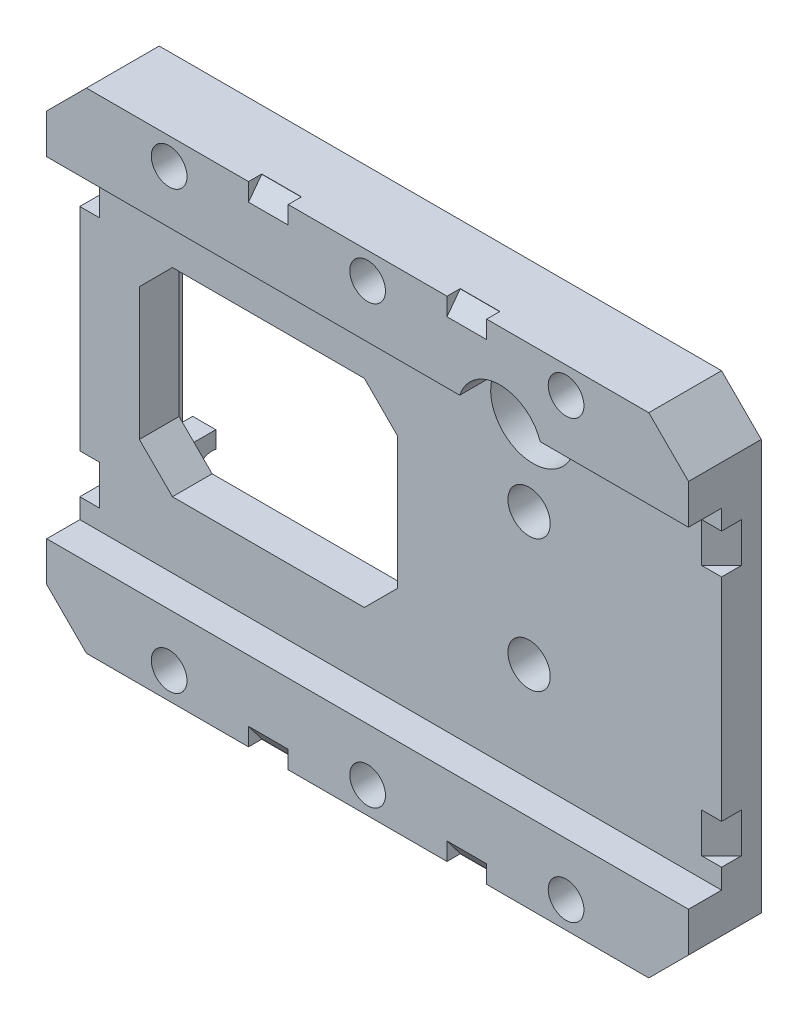
from build123d import *
from OCP.BRepFilletAPI import BRepFilletAPI_MakeChamfer

# Parameters (mm, degrees)
SKETCH_1_W                  = 48.5
SKETCH_1_H                  = 37
EXTRUDE_1_DEPTH             = 7.5
SKETCH_2_W                  = 4.5
SKETCH_2_H                  = 25
CUT_EXTRUDE_1_DEPTH         = 54.398977368
SKETCH_3_W                  = 41
SKETCH_3_H                  = 27.5
EXTRUDE_2_DEPTH             = 3.028
SKETCH_4_W                  = 38.25
SKETCH_4_H                  = 25
CUT_EXTRUDE_2_DEPTH         = 3.028
CUT_EXTRUDE_3_DEPTH         = 49.015109955
CUT_EXTRUDE_4_DEPTH         = 52.139033859
CUT_EXTRUDE_5_DEPTH         = 32.090983966
HOLE_WIZARD_2_5_2_5_1_D     = 2.5
HOLE_WIZARD_2_5_2_5_1_DEPTH = 1.75
HOLE_WIZARD_2_5_2_5_2_D     = 2.5
HOLE_WIZARD_2_5_2_5_2_DEPTH = 6
HOLE_WIZARD_2_5_2_5_3_D     = 2.5
HOLE_WIZARD_2_5_2_5_3_DEPTH = 4.25
HOLE_WIZARD_2_7_2_7_1_D     = 2.7
CHAMFER_1_SIZE              = 3
SKETCH_17_W                 = 3
SKETCH_17_H                 = 4
CUT_EXTRUDE_8_DEPTH         = 3
CHAMFER_2_SIZE              = 3
CHAMFER_2_SIZE_2            = 3.981134465
SKETCH_19_W                 = 2
SKETCH_19_H                 = 3
CUT_EXTRUDE_9_DEPTH         = 1.5
CHAMFER_3_SIZE              = 2
CHAMFER_4_SIZE              = 1
SKETCH_20_R                 = 3.2
CUT_EXTRUDE_10_DEPTH        = 21.5
SKETCH_21_W                 = 19.5
SKETCH_21_H                 = 15
CUT_EXTRUDE_11_DEPTH        = 21.5
CHAMFER_5_SIZE              = 2.5
SKETCH_22_W                 = 9
SKETCH_22_H                 = 15
CUT_EXTRUDE_12_DEPTH        = 51.5
SKETCH_23_W                 = 48.5
SKETCH_23_H                 = 2
CUT_EXTRUDE_13_DEPTH        = 50
SKETCH_24_R                 = 1.6
CUT_EXTRUDE_14_DEPTH        = 10


# Some blends are built 0.0001 mm under size
with BuildPart() as part:
    # 草图1 → 凸台-拉伸1 (new body)
    with BuildSketch(Plane(origin=(0, 0, 5.028), x_dir=(-1, 0, 0), z_dir=(0, 0, -1))):
        Rectangle(SKETCH_1_W, SKETCH_1_H)
    extrude(amount=-EXTRUDE_1_DEPTH)

    # 草图2 → 切除-拉伸1 (cut, through all)
    with BuildSketch(Plane(origin=(24.25, 0, 0), x_dir=(0, 0, -1), z_dir=(1, 0, 0))):
        with Locations((-10.278, 0)):
            Rectangle(SKETCH_2_W, SKETCH_2_H)
    extrude(amount=-CUT_EXTRUDE_1_DEPTH, mode=Mode.SUBTRACT)

    # 草图3 → 凸台-拉伸2 (add)
    with BuildSketch(Plane(origin=(0, 0, 5.028), x_dir=(-1, 0, 0), z_dir=(0, 0, -1))):
        with Locations((1.25, 0)):
            Rectangle(SKETCH_3_W, SKETCH_3_H)
    extrude(amount=EXTRUDE_2_DEPTH)

    # 草图4 → 切除-拉伸2 (cut)
    with BuildSketch(Plane(origin=(0, 0, 2), x_dir=(-1, 0, 0), z_dir=(0, 0, -1))):
        with Locations((0.875, 0)):
            Rectangle(SKETCH_4_W, SKETCH_4_H)
    extrude(amount=-CUT_EXTRUDE_2_DEPTH, mode=Mode.SUBTRACT)

    # 草图5 → 切除-拉伸3 (cut, through all)
    with BuildSketch(Plane.ZY.offset(-18.25)):
        with BuildLine():
            Line((2, 7.034395212), (2, -7.034395212))
            ThreePointArc((2, -7.034395212), (4.278, 0), (2, 7.034395212))
        make_face()
    extrude(amount=-CUT_EXTRUDE_3_DEPTH, mode=Mode.SUBTRACT)

    # 草图6 → 切除-拉伸4 (cut, through all)
    with BuildSketch(Plane.ZY.offset(21.75)):
        with BuildLine():
            Line((2, 7.034395212), (2, -7.034395212))
            ThreePointArc((2, -7.034395212), (4.278, 0), (2, 7.034395212))
        make_face()
    extrude(amount=-CUT_EXTRUDE_4_DEPTH, mode=Mode.SUBTRACT)

    # 草图7 → 切除-拉伸5 (cut, through all)
    with BuildSketch(Plane.XY.offset(8.028)):
        with BuildLine():
            Line((-7.978419869, 7.029222073), (-13.021580131, 7.029222073))
            ThreePointArc((-13.021580131, 7.029222073), (-17.801221513, 4.934335949), (-19.5, 0))
            ThreePointArc((-19.5, 0), (-17.801221513, -4.934335949), (-13.021580131, -7.029222073))
            Line((-13.021580131, -7.029222073), (-7.978419869, -7.029222073))
            ThreePointArc((-7.978419869, -7.029222073), (-3.198778487, -4.934335949), (-1.5, 0))
            ThreePointArc((-1.5, 0), (-3.198778487, 4.934335949), (-7.978419869, 7.029222073))
        make_face()
    extrude(amount=-CUT_EXTRUDE_5_DEPTH, mode=Mode.SUBTRACT)

    # Ø2.5 (2.5) 直径孔1
    with Locations(Plane.ZY.offset(21.75)):
        with Locations((2.278, 10)):
            Hole(HOLE_WIZARD_2_5_2_5_1_D / 2, depth=HOLE_WIZARD_2_5_2_5_1_DEPTH)

    # Ø2.5 (2.5) 直径孔2
    with Locations(Plane.ZY.offset(-18.25)):
        with Locations((2.278, -10), (2.278, 10)):
            Hole(HOLE_WIZARD_2_5_2_5_2_D / 2, depth=HOLE_WIZARD_2_5_2_5_2_DEPTH)

    # Ø2.5 (2.5) 直径孔3
    with Locations(Plane(origin=(-20, 0, 0), x_dir=(0, 0, -1), z_dir=(1, 0, 0))):
        with Locations((-2.278, -10)):
            Hole(HOLE_WIZARD_2_5_2_5_3_D / 2, depth=HOLE_WIZARD_2_5_2_5_3_DEPTH)

    # Ø2.7 (2.7) 直径孔1 (through all)
    with Locations(Plane.XY.offset(12.528)):
        with Locations((0, -16.5), (-15, -16.5), (15, -16.5), (0, 16.5), (-15, 16.5), (15, 16.5)):
            Hole(HOLE_WIZARD_2_7_2_7_1_D / 2)

    # 倒角1
    chamfer_1_edges = [part.edges().sort_by_distance(p)[0] for p in [
        (-24.25, 18.5, 8.778),
        (-24.25, -18.5, 8.778),
        (24.25, -18.5, 8.778),
        (24.25, 18.5, 8.778),
    ]]
    chamfer(chamfer_1_edges, length=CHAMFER_1_SIZE)

    # 草图17 → 切除-拉伸8 (cut)
    with BuildSketch(Plane.XY.offset(12.528)):
        with Locations((-7.5, -16.5)):
            Rectangle(SKETCH_17_W, SKETCH_17_H)
        with Locations((7.5, -16.5)):
            Rectangle(SKETCH_17_W, SKETCH_17_H)
        with Locations((7.5, 16.5)):
            Rectangle(SKETCH_17_W, SKETCH_17_H)
        with Locations((-7.5, 16.5)):
            Rectangle(SKETCH_17_W, SKETCH_17_H)
    extrude(amount=-CUT_EXTRUDE_8_DEPTH, mode=Mode.SUBTRACT)

    # 倒角2
    chamfer_2_edges_1 = [part.edges().sort_by_distance(p)[0] for p in [
        (7.5, -14.5, 9.528),
    ]]
    chamfer_2_side_1 = [part.faces().sort_by_distance(p)[0] for p in [
        (7.5, -14.5, 9.588),
    ]]
    chamfer_2_edges_2 = [part.edges().sort_by_distance(p)[0] for p in [
        (-7.5, -14.5, 9.528),
    ]]
    chamfer_2_side_2 = [part.faces().sort_by_distance(p)[0] for p in [
        (-7.5, -14.5, 9.588),
    ]]
    chamfer_2_edges_3 = [part.edges().sort_by_distance(p)[0] for p in [
        (-7.5, 14.5, 9.528),
    ]]
    chamfer_2_side_3 = [part.faces().sort_by_distance(p)[0] for p in [
        (-7.5, 14.5, 9.588),
    ]]
    chamfer_2_edges_4 = [part.edges().sort_by_distance(p)[0] for p in [
        (7.5, 14.5, 9.528),
    ]]
    chamfer_2_side_4 = [part.faces().sort_by_distance(p)[0] for p in [
        (7.5, 14.5, 9.588),
    ]]
    chamfer_2 = BRepFilletAPI_MakeChamfer(part.part.solid().wrapped)
    for e in chamfer_2_edges_1:
        chamfer_2.Add(CHAMFER_2_SIZE - 0.0001, CHAMFER_2_SIZE_2 - 0.0001, e.wrapped, chamfer_2_side_1[0].wrapped)
    for e in chamfer_2_edges_2:
        chamfer_2.Add(CHAMFER_2_SIZE - 0.0001, CHAMFER_2_SIZE_2 - 0.0001, e.wrapped, chamfer_2_side_2[0].wrapped)
    for e in chamfer_2_edges_3:
        chamfer_2.Add(CHAMFER_2_SIZE - 0.0001, CHAMFER_2_SIZE_2 - 0.0001, e.wrapped, chamfer_2_side_3[0].wrapped)
    for e in chamfer_2_edges_4:
        chamfer_2.Add(CHAMFER_2_SIZE - 0.0001, CHAMFER_2_SIZE_2 - 0.0001, e.wrapped, chamfer_2_side_4[0].wrapped)
    add(Compound.cast(chamfer_2.Shape()), mode=Mode.REPLACE)  # a hair under: the kernel refuses the full size

    # 草图19 → 切除-拉伸9 (cut)
    with BuildSketch(Plane.XY.offset(8.028)):
        with Locations((-23.25, -9.5)):
            Rectangle(SKETCH_19_W, SKETCH_19_H)
        with Locations((-23.25, 9.5)):
            Rectangle(SKETCH_19_W, SKETCH_19_H)
        with Locations((23.25, 9.5)):
            Rectangle(SKETCH_19_W, SKETCH_19_H)
        with Locations((23.25, -9.5)):
            Rectangle(SKETCH_19_W, SKETCH_19_H)
    extrude(amount=-CUT_EXTRUDE_9_DEPTH, mode=Mode.SUBTRACT)

    # 倒角3
    # the kernel refuses this chamfer: 2 mm, written as the material it adds along each edge
    with BuildSketch(Plane(origin=(22.25, 11, 6.528), x_dir=(0.9996219169112968, 0, -0.02749587661058651), z_dir=(0, -1, 0))) as chamfer_3_piece_1_section:
        Polygon((CHAMFER_3_SIZE * 0.999621916911, CHAMFER_3_SIZE * 0.0274958766106), (-CHAMFER_3_SIZE * 0.0274958766106, CHAMFER_3_SIZE * 0.999621916911), (0, 0), align=None)
    chamfer_3_piece_1 = extrude(amount=8.143365976, mode=Mode.PRIVATE)
    chamfer_3_piece_1 = split(chamfer_3_piece_1, bisect_by=Plane(origin=(22.95, 9.5, 8.028), z_dir=(0, 0, -1)), keep=Keep.TOP, mode=Mode.PRIVATE)
    add(chamfer_3_piece_1)
    with BuildSketch(Plane(origin=(22.25, -11, 6.528), x_dir=(0.9996219169112968, 0, -0.02749587661058651), z_dir=(0, 1, 0))) as chamfer_3_piece_2_section:
        Polygon((CHAMFER_3_SIZE * 0.999621916911, -CHAMFER_3_SIZE * 0.0274958766106), (-CHAMFER_3_SIZE * 0.0274958766106, -CHAMFER_3_SIZE * 0.999621916911), (0, 0), align=None)
    chamfer_3_piece_2 = extrude(amount=8.143365976, mode=Mode.PRIVATE)
    chamfer_3_piece_2 = split(chamfer_3_piece_2, bisect_by=Plane(origin=(22.95, -9.5, 8.028), z_dir=(0, 0, -1)), keep=Keep.TOP, mode=Mode.PRIVATE)
    add(chamfer_3_piece_2)
    with BuildSketch(Plane(origin=(-22.25, 11, 6.528), x_dir=(-0.9996219169112968, 0, -0.02749587661058651), z_dir=(0, -1, 0))) as chamfer_3_piece_3_section:
        Polygon((CHAMFER_3_SIZE * 0.999621916911, -CHAMFER_3_SIZE * 0.0274958766106), (-CHAMFER_3_SIZE * 0.0274958766106, -CHAMFER_3_SIZE * 0.999621916911), (0, 0), align=None)
    chamfer_3_piece_3 = extrude(amount=8.143365976, mode=Mode.PRIVATE)
    chamfer_3_piece_3 = split(chamfer_3_piece_3, bisect_by=Plane(origin=(-22.95, 9.5, 8.028), z_dir=(0, 0, -1)), keep=Keep.TOP, mode=Mode.PRIVATE)
    add(chamfer_3_piece_3)
    with BuildSketch(Plane(origin=(-22.25, -16.143365976, 6.528), x_dir=(-0.9996219169112968, 0, -0.02749587661058651), z_dir=(0, 1, 0))) as chamfer_3_piece_4_section:
        Polygon((CHAMFER_3_SIZE * 0.999621916911, CHAMFER_3_SIZE * 0.0274958766106), (-CHAMFER_3_SIZE * 0.0274958766106, CHAMFER_3_SIZE * 0.999621916911), (0, 0), align=None)
    chamfer_3_piece_4 = extrude(amount=13.286731952, mode=Mode.PRIVATE)
    chamfer_3_piece_4 = split(chamfer_3_piece_4, bisect_by=Plane(origin=(-22.95, -9.5, 8.028), z_dir=(0, 0, -1)), keep=Keep.TOP, mode=Mode.PRIVATE)
    chamfer_3_piece_4 = split(chamfer_3_piece_4, bisect_by=Plane(origin=(-26.6, -13.15, 7.128), z_dir=(0.7071067811865476, 0.7071067811865476, 0)), keep=Keep.TOP, mode=Mode.PRIVATE)
    add(chamfer_3_piece_4)

    # 倒角4
    chamfer_4_edges = [part.edges().sort_by_distance(p)[0] for p in [
        (-21.75, 13.75, 3.514),
        (19.25, 13.75, 3.514),
        (19.25, -13.75, 3.514),
        (-21.75, -13.75, 3.514),
    ]]
    chamfer(chamfer_4_edges, length=CHAMFER_4_SIZE)

    # 草图20 → 切除-拉伸10 (cut)
    with BuildSketch(Plane(origin=(0, 0, 2), x_dir=(-1, 0, 0), z_dir=(0, 0, -1))):
        with Locations(Location((-10, 11.5, 0), (0, 0, 18.209956864))):
            Circle(SKETCH_20_R)
    extrude(amount=-CUT_EXTRUDE_10_DEPTH, mode=Mode.SUBTRACT)

    # 草图21 → 切除-拉伸11 (cut)
    with BuildSketch(Plane.XY.offset(8.028)):
        with Locations((-10, 0)):
            Rectangle(SKETCH_21_W, SKETCH_21_H)
    extrude(amount=-CUT_EXTRUDE_11_DEPTH, mode=Mode.SUBTRACT)

    # 倒角5
    chamfer_5_edges = [part.edges().sort_by_distance(p)[0] for p in [
        (-0.25, 7.5, 6.528),
        (-0.25, -7.5, 6.528),
        (-19.75, -7.5, 6.528),
        (-19.75, 7.5, 6.528),
    ]]
    chamfer(chamfer_5_edges, length=CHAMFER_5_SIZE)

    # 草图22 → 切除-拉伸12 (cut)
    with BuildSketch(Plane(origin=(19.25, 0, 0), x_dir=(0, 0, -1), z_dir=(1, 0, 0))):
        Rectangle(SKETCH_22_W, SKETCH_22_H)
    extrude(amount=-CUT_EXTRUDE_12_DEPTH, mode=Mode.SUBTRACT)

    # 草图23 → 切除-拉伸13 (cut)
    with BuildSketch(Plane.XZ.offset(18.5)):
        with Locations((0, 11.528)):
            Rectangle(SKETCH_23_W, SKETCH_23_H)
    extrude(amount=-CUT_EXTRUDE_13_DEPTH, mode=Mode.SUBTRACT)

    # 草图24 → 切除-拉伸14 (cut)
    with BuildSketch(Plane.XY.offset(8.028)):
        with Locations((9.703840341, 5)):
            Circle(SKETCH_24_R)
        with Locations(Location((9.703840341, -5, 0), (0, 0, 180))):
            Circle(SKETCH_24_R)
    extrude(amount=-CUT_EXTRUDE_14_DEPTH, mode=Mode.SUBTRACT)


solid = part.part
